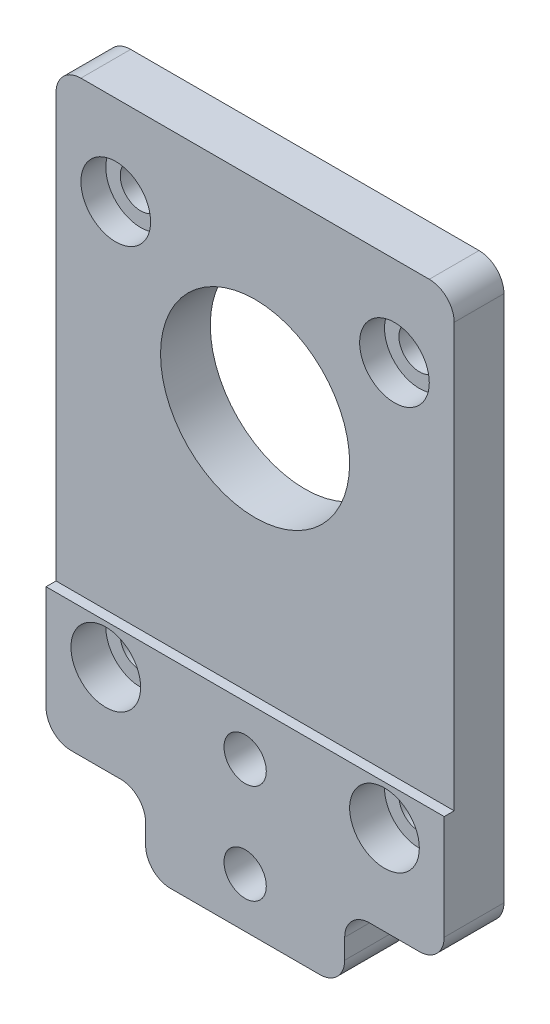
from build123d import *
from build123d.topology import SkipClean

# Parameters (mm, degrees)
SKETCH1_R           = 2.125
BOSS_EXTRUDE2_DEPTH = 6
SKETCH7_W           = 40
SKETCH7_H           = 58
BOSS_EXTRUDE3_DEPTH = 6
FILLET1_R           = 2.5
SKETCH3_R           = 9.5
CUT_EXTRUDE2_DEPTH  = 55.184868737
SKETCH2_R           = 2.05
CUT_EXTRUDE1_DEPTH  = 55.184868737
SKETCH6_W           = 60
SKETCH6_H           = 50
CUT_EXTRUDE5_DEPTH  = 1
SKETCH9_R           = 2.125
CUT_EXTRUDE7_DEPTH  = 55.184868737
SKETCH11_R          = 3.5
CUT_EXTRUDE9_DEPTH  = 3.5


with BuildPart() as part:
    # Sketch1 → Boss-Extrude2 (new body)
    with BuildSketch(Plane.XY):
        with BuildLine():
            Line((-10, -15), (-10, 15))
            Line((-10, 15), (-15, 30))
            ThreePointArc((-15, 30), (0, 45), (15, 30))
            Line((15, 30), (10, 15))
            Line((10, 15), (10, -15))
            Line((10, -15), (-10, -15))
        make_face()
        Circle(SKETCH1_R, mode=Mode.SUBTRACT)
        with Locations((0, -10)):
            Circle(SKETCH1_R, mode=Mode.SUBTRACT)
    extrude(amount=BOSS_EXTRUDE2_DEPTH)

    # Sketch7 → Boss-Extrude3 (add)
    with BuildSketch(Plane(origin=(0, 0, 0), x_dir=(-1, 0, 0), z_dir=(0, 0, -1))):
        with Locations((0, 21)):
            Rectangle(SKETCH7_W, SKETCH7_H)
    extrude(amount=-BOSS_EXTRUDE3_DEPTH)

    # Fillet1
    fillet1_edges = [part.edges().sort_by_distance(p)[0] for p in [
        (10, -15, 3),
        (-10, -15, 3),
        (20, 50, 3),
        (10, -8, 3),
        (20, -8, 3),
        (-20, 50, 3),
        (-20, -8, 3),
        (-10, -8, 3),
    ]]
    fillet(fillet1_edges, radius=FILLET1_R)

    # Sketch3 → Cut-Extrude2 (cut, through all)
    with BuildSketch(Plane.XY.offset(6)):
        with Locations((0, 30)):
            Circle(SKETCH3_R)
    extrude(amount=-CUT_EXTRUDE2_DEPTH, mode=Mode.SUBTRACT)

    # Sketch2 → Cut-Extrude1 (cut, through all)
    with BuildSketch(Plane.XY.offset(6)):
        with Locations((-14, 41)):
            Circle(SKETCH2_R)
        with Locations((14, 41)):
            Circle(SKETCH2_R)
        with Locations((14, 1)):
            Circle(SKETCH2_R)
        with Locations((-14, 1)):
            Circle(SKETCH2_R)
    extrude(amount=-CUT_EXTRUDE1_DEPTH, mode=Mode.SUBTRACT)

    # Sketch6 → Cut-Extrude5 (cut)
    with BuildSketch(Plane.XY.offset(6)):
        with Locations((0, 30)):
            Rectangle(SKETCH6_W, SKETCH6_H)
    extrude(amount=-CUT_EXTRUDE5_DEPTH, mode=Mode.SUBTRACT)

    # Sketch9 → Cut-Extrude7 (cut, through all)
    with SkipClean():  # the faces are left unmerged after this step: merging them gives an invalid solid
        with BuildSketch(Plane.XY.offset(6)):
            with Locations((0, -10)):
                Circle(SKETCH9_R)
            Circle(SKETCH9_R)
        extrude(amount=-CUT_EXTRUDE7_DEPTH, mode=Mode.SUBTRACT)

    # Sketch11 → Cut-Extrude9 (cut)
    with SkipClean():  # the faces are left unmerged after this step: merging them gives an invalid solid
        with BuildSketch(Plane.XY.offset(6)):
            with Locations((-14, 1)):
                Circle(SKETCH11_R)
            with Locations((14, 1)):
                Circle(SKETCH11_R)
            with Locations((14, 41)):
                Circle(SKETCH11_R)
            with Locations((-14, 41)):
                Circle(SKETCH11_R)
        extrude(amount=-CUT_EXTRUDE9_DEPTH, mode=Mode.SUBTRACT)


solid = part.part
